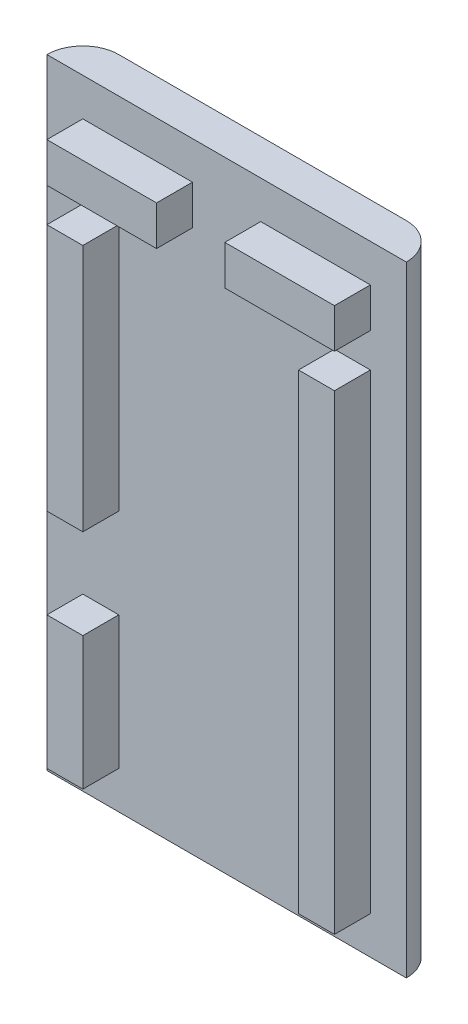
from build123d import *

# Parameters (mm, degrees)
SKETCH1_W               = 34.5
SKETCH1_H               = 20
BOSS_EXTRUDE1_DEPTH     = 2
FILLET1_R               = 2
SKETCH2_W               = 16
SKETCH2_H               = 2.2
SKETCH2_W_2             = 2
SKETCH2_H_2             = 7.4
SKETCH2_H_3             = 26.2
SKETCH2_H_4             = 13.8
BOSS_EXTRUDE2_DEPTH     = 2
CUT_EXTRUDE1_DEPTH      = 1.9
CUT_EXTRUDE1_DEPTH_BACK = 1.9
SKETCH3_W               = 2.2
SKETCH3_H               = 2


with BuildPart() as part:
    # Sketch1 → Boss-Extrude1 (new body)
    with BuildSketch(Plane(origin=(0, 0, 0), x_dir=(0, 1, 0), z_dir=(0, 0, 1))):
        Rectangle(SKETCH1_W, SKETCH1_H)
    extrude(amount=BOSS_EXTRUDE1_DEPTH)

    # Fillet1
    fillet1_edges = [part.edges().sort_by_distance(p)[0] for p in [
        (-10, 0, 0),
        (10, 0, 0),
    ]]
    fillet(fillet1_edges, radius=FILLET1_R - 0.0001)  # a hair under: the kernel refuses the full size

    # Sketch2 → Boss-Extrude2 (add)
    with BuildSketch(Plane.XY.offset(2)):
        with Locations((0, 14.05)):
            Rectangle(SKETCH2_W, SKETCH2_H)
        with Locations((-7, -11.45)):
            Rectangle(SKETCH2_W_2, SKETCH2_H_2)
        with Locations((7, -2.05)):
            Rectangle(SKETCH2_W_2, SKETCH2_H_3)
        with Locations((-7, 4.15)):
            Rectangle(SKETCH2_W_2, SKETCH2_H_4)
    extrude(amount=BOSS_EXTRUDE2_DEPTH)

    # Sketch3 → Cut-Extrude1 (cut, two sides: drawn at the far end of the back side and taken through both)
    with BuildSketch(Plane.YZ.offset(-CUT_EXTRUDE1_DEPTH_BACK)):
        with Locations((14.05, 3)):
            Rectangle(SKETCH3_W, SKETCH3_H)
    extrude(amount=CUT_EXTRUDE1_DEPTH + CUT_EXTRUDE1_DEPTH_BACK, mode=Mode.SUBTRACT)


solid = part.part
